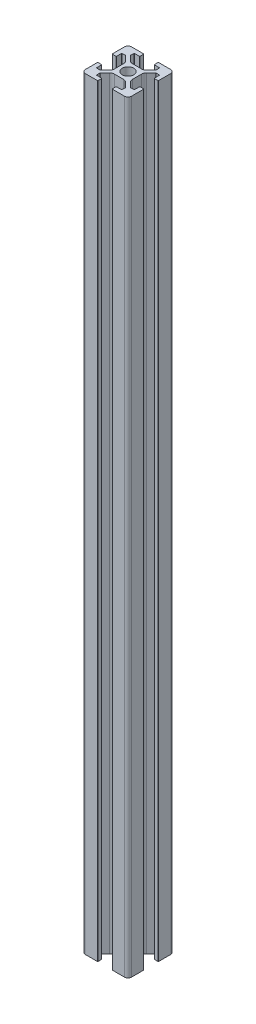
from build123d import *

# Parameters (mm, degrees)
SKETCH1_R           = 2.5
BOSS_EXTRUDE1_DEPTH = 330
FILLET1_R           = 1.5
FILLET2_R           = 0.2
FILLET3_R           = 2
SKETCH2_R           = 2.1
CUT_EXTRUDE1_DEPTH  = 332.209903234


with BuildPart() as part:
    # Sketch1 → Boss-Extrude1 (new body)
    with BuildSketch(Plane(origin=(0, 0, 0), x_dir=(1, 0, 0), z_dir=(0, 1, 0))):
        Polygon((0, 6.9), (0, 0), (6.9, 0), (6.9, 1.8), (4.5, 1.8), (4.5, 3.439339828), (7.160660172, 6.1), (12.839339828, 6.1), (15.5, 3.439339828), (15.5, 1.8), (13.1, 1.8), (13.1, 0), (20, 0), (20, 6.9), (18.2, 6.9), (18.2, 4.5), (16.560660172, 4.5), (13.9, 7.160660172), (13.9, 12.839339828), (16.560660172, 15.5), (18.2, 15.5), (18.2, 13.1), (20, 13.1), (20, 20), (13.1, 20), (13.1, 18.2), (15.5, 18.2), (15.5, 16.560660172), (12.839339828, 13.9), (7.160660172, 13.9), (4.5, 16.560660172), (4.5, 18.2), (6.9, 18.2), (6.9, 20), (0, 20), (0, 13.1), (1.8, 13.1), (1.8, 15.5), (3.439339828, 15.5), (6.1, 12.839339828), (6.1, 7.160660172), (3.439339828, 4.5), (1.8, 4.5), (1.8, 6.9), align=None)
        with Locations((10, 10)):
            Circle(SKETCH1_R, mode=Mode.SUBTRACT)
    extrude(amount=BOSS_EXTRUDE1_DEPTH)

    # Fillet1
    fillet1_edges = [part.edges().sort_by_distance(p)[0] for p in [
        (0, 165, -20),
        (0, 165, 0),
        (20, 165, -20),
        (20, 165, 0),
    ]]
    fillet(fillet1_edges, radius=FILLET1_R)

    # Fillet2
    fillet2_edges = [part.edges().sort_by_distance(p)[0] for p in [
        (20, 165, -13.1),
        (6.9, 165, -18.2),
        (0, 165, -13.1),
        (13.1, 165, -18.2),
        (18.2, 165, -13.1),
        (13.1, 165, 0),
        (13.1, 165, -1.8),
        (6.9, 165, 0),
        (6.9, 165, -1.8),
        (0, 165, -6.9),
        (1.8, 165, -6.9),
        (1.8, 165, -13.1),
        (6.9, 165, -20),
        (13.1, 165, -20),
        (18.2, 165, -6.9),
        (20, 165, -6.9),
        (4.5, 165, -3.439339828),
        (15.5, 165, -3.439339828),
        (18.2, 165, -4.5),
        (16.560660172, 165, -4.5),
        (18.2, 165, -15.5),
        (16.560660172, 165, -15.5),
        (15.5, 165, -16.560660172),
        (15.5, 165, -18.2),
        (4.5, 165, -16.560660172),
        (4.5, 165, -18.2),
        (3.439339828, 165, -15.5),
        (1.8, 165, -15.5),
        (3.439339828, 165, -4.5),
        (1.8, 165, -4.5),
        (15.5, 165, -1.8),
        (4.5, 165, -1.8),
    ]]
    fillet(fillet2_edges, radius=FILLET2_R)

    # Fillet3
    fillet3_edges = [part.edges().sort_by_distance(p)[0] for p in [
        (13.9, 165, -7.160660172),
        (12.839339828, 165, -6.1),
        (7.160660172, 165, -6.1),
        (6.1, 165, -12.839339828),
        (6.1, 165, -7.160660172),
        (12.839339828, 165, -13.9),
        (7.160660172, 165, -13.9),
        (13.9, 165, -12.839339828),
    ]]
    fillet(fillet3_edges, radius=FILLET3_R)

    # Sketch2 → Cut-Extrude1 (cut, through all)
    with BuildSketch(Plane(origin=(0, 0, -20), x_dir=(-1, 0, 0), z_dir=(0, 0, -1))):
        with Locations((-10, 297)):
            Circle(SKETCH2_R)
        with Locations((-10, 254)):
            Circle(SKETCH2_R)
        with Locations((-10, 53)):
            Circle(SKETCH2_R)
        with Locations((-10, 10)):
            Circle(SKETCH2_R)
    extrude(amount=-CUT_EXTRUDE1_DEPTH, mode=Mode.SUBTRACT)


solid = part.part
